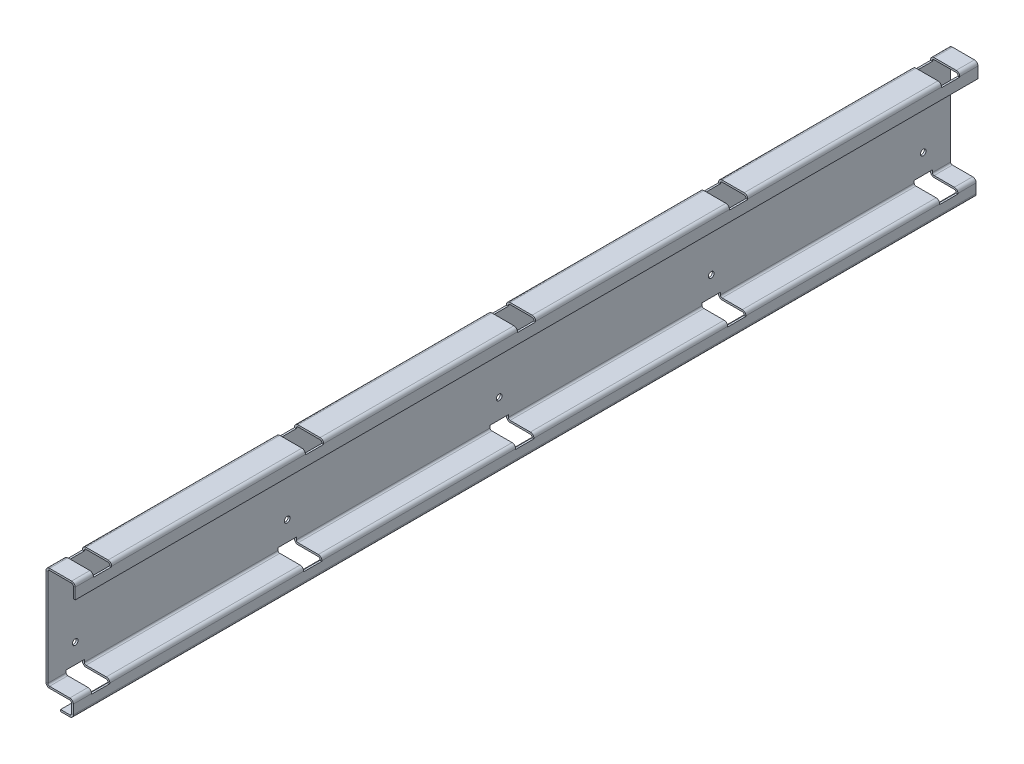
from build123d import *

# Parameters (mm, degrees)
BASE_FLANGE1_DEPTH  = 495
SKETCH6_W           = 32.5
SKETCH6_H           = 20
CUT_EXTRUDE1_DEPTH  = 4.5
LPATTERN1_COUNT     = 3
LPATTERN1_PITCH     = 232.5
LPATTERN1_COL_COUNT = 3
LPATTERN1_COL_PITCH = 232.5
SKETCH7_W           = 32.5
SKETCH7_H           = 20
CUT_EXTRUDE2_DEPTH  = 4.5
LPATTERN2_COUNT     = 3
LPATTERN2_PITCH     = 232.5
LPATTERN2_COL_COUNT = 3
LPATTERN2_COL_PITCH = 232.5
SKETCH8_R           = 3
CUT_EXTRUDE3_DEPTH  = 5
LPATTERN3_COUNT     = 3
LPATTERN3_PITCH     = 232.5
LPATTERN3_COL_COUNT = 3
LPATTERN3_COL_PITCH = 232.5
SKETCH9_R           = 3.125
CUT_EXTRUDE4_DEPTH  = 10
LPATTERN4_COUNT     = 3
LPATTERN4_PITCH     = 232.5
LPATTERN4_COL_COUNT = 3
LPATTERN4_COL_PITCH = 232.5


# Sheet-metal steps are written as plain solids
with BuildPart() as part:
    # Sketch1 → Base-Flange1 (new, symmetric)
    with BuildSketch(Plane.XY):
        with BuildLine():
            Line((0, 114), (0, 126.1))
            ThreePointArc((0, 126.1), (-0.556497116, 127.443502884), (-1.9, 128))
            Line((-1.9, 128), (-26.1, 128))
            ThreePointArc((-26.1, 128), (-27.443502884, 127.443502884), (-28, 126.1))
            Line((-28, 126.1), (-28, 19.9))
            ThreePointArc((-28, 19.9), (-27.443502884, 18.556497116), (-26.1, 18))
            Line((-26.1, 18), (-3.9, 18))
            ThreePointArc((-3.9, 18), (-1.142283553, 16.857716447), (0, 14.1))
            Line((0, 14.1), (0, 3.9))
            ThreePointArc((0, 3.9), (-1.142283553, 1.142283553), (-3.9, 0))
            Line((-3.9, 0), (-14, 0))
            Line((-14, 0), (-14, 2))
            Line((-14, 2), (-3.9, 2))
            ThreePointArc((-3.9, 2), (-2.556497116, 2.556497116), (-2, 3.9))
            Line((-2, 3.9), (-2, 14.1))
            ThreePointArc((-2, 14.1), (-2.556497116, 15.443502884), (-3.9, 16))
            Line((-3.9, 16), (-26.1, 16))
            ThreePointArc((-26.1, 16), (-28.857716447, 17.142283553), (-30, 19.9))
            Line((-30, 19.9), (-30, 126.1))
            ThreePointArc((-30, 126.1), (-28.857716447, 128.857716447), (-26.1, 130))
            Line((-26.1, 130), (-1.9, 130))
            ThreePointArc((-1.9, 130), (0.857716447, 128.857716447), (2, 126.1))
            Line((2, 126.1), (2, 114))
            Line((2, 114), (0, 114))
        make_face()
    extrude(amount=BASE_FLANGE1_DEPTH, both=True)

    # Sketch6 → Cut-Extrude1 (cut)
    with BuildSketch(Plane(origin=(0, 130, 0), x_dir=(1, 0, 0), z_dir=(0, 1, 0))):
        with Locations((-14, 0)):
            Rectangle(SKETCH6_W, SKETCH6_H)
    cut_extrude1 = extrude(amount=-CUT_EXTRUDE1_DEPTH, mode=Mode.SUBTRACT)

    # LPattern1: Cut-Extrude1 ×3
    with Locations(*[(0, 0, i * LPATTERN1_PITCH) for i in range(1, LPATTERN1_COUNT)]):
        add(cut_extrude1, mode=Mode.SUBTRACT)

    # LPattern1 col: Cut-Extrude1 ×3
    with Locations(*[(0, 0, -i * LPATTERN1_COL_PITCH) for i in range(1, LPATTERN1_COL_COUNT)]):
        add(cut_extrude1, mode=Mode.SUBTRACT)

    # Sketch7 → Cut-Extrude2 (cut, symmetric)
    with BuildSketch(Plane(origin=(0, 18, 0), x_dir=(1, 0, 0), z_dir=(0, 1, 0))):
        with Locations((-14, 0)):
            Rectangle(SKETCH7_W, SKETCH7_H)
    cut_extrude2 = extrude(amount=CUT_EXTRUDE2_DEPTH, both=True, mode=Mode.SUBTRACT)

    # LPattern2: Cut-Extrude2 ×3
    with Locations(*[(0, 0, -i * LPATTERN2_PITCH) for i in range(1, LPATTERN2_COUNT)]):
        add(cut_extrude2, mode=Mode.SUBTRACT)

    # LPattern2 col: Cut-Extrude2 ×3
    with Locations(*[(0, 0, i * LPATTERN2_COL_PITCH) for i in range(1, LPATTERN2_COL_COUNT)]):
        add(cut_extrude2, mode=Mode.SUBTRACT)

    # Sketch8 → Cut-Extrude3 (cut)
    with BuildSketch(Plane(origin=(0, 2, 0), x_dir=(1, 0, 0), z_dir=(0, 1, 0))):
        with Locations(Location((-8.95, 0, 0), (0, 0, 180))):
            Circle(SKETCH8_R)
    cut_extrude3 = extrude(amount=-CUT_EXTRUDE3_DEPTH, mode=Mode.SUBTRACT)

    # LPattern3: Cut-Extrude3 ×3
    with Locations(*[(0, 0, -i * LPATTERN3_PITCH) for i in range(1, LPATTERN3_COUNT)]):
        add(cut_extrude3, mode=Mode.SUBTRACT)

    # LPattern3 col: Cut-Extrude3 ×3
    with Locations(*[(0, 0, i * LPATTERN3_COL_PITCH) for i in range(1, LPATTERN3_COL_COUNT)]):
        add(cut_extrude3, mode=Mode.SUBTRACT)

    # Sketch9 → Cut-Extrude4 (cut)
    with BuildSketch(Plane.ZY.offset(30)):
        with Locations(Location((0, 104, 0), (0, 0, 270))):
            Circle(SKETCH9_R)
        with Locations(Location((0, 44, 0), (0, 0, 270))):
            Circle(SKETCH9_R)
    cut_extrude4 = extrude(amount=-CUT_EXTRUDE4_DEPTH, mode=Mode.SUBTRACT)

    # LPattern4: Cut-Extrude4 ×3
    with Locations(*[(0, 0, -i * LPATTERN4_PITCH) for i in range(1, LPATTERN4_COUNT)]):
        add(cut_extrude4, mode=Mode.SUBTRACT)

    # LPattern4 col: Cut-Extrude4 ×3
    with Locations(*[(0, 0, i * LPATTERN4_COL_PITCH) for i in range(1, LPATTERN4_COL_COUNT)]):
        add(cut_extrude4, mode=Mode.SUBTRACT)


solid = part.part
